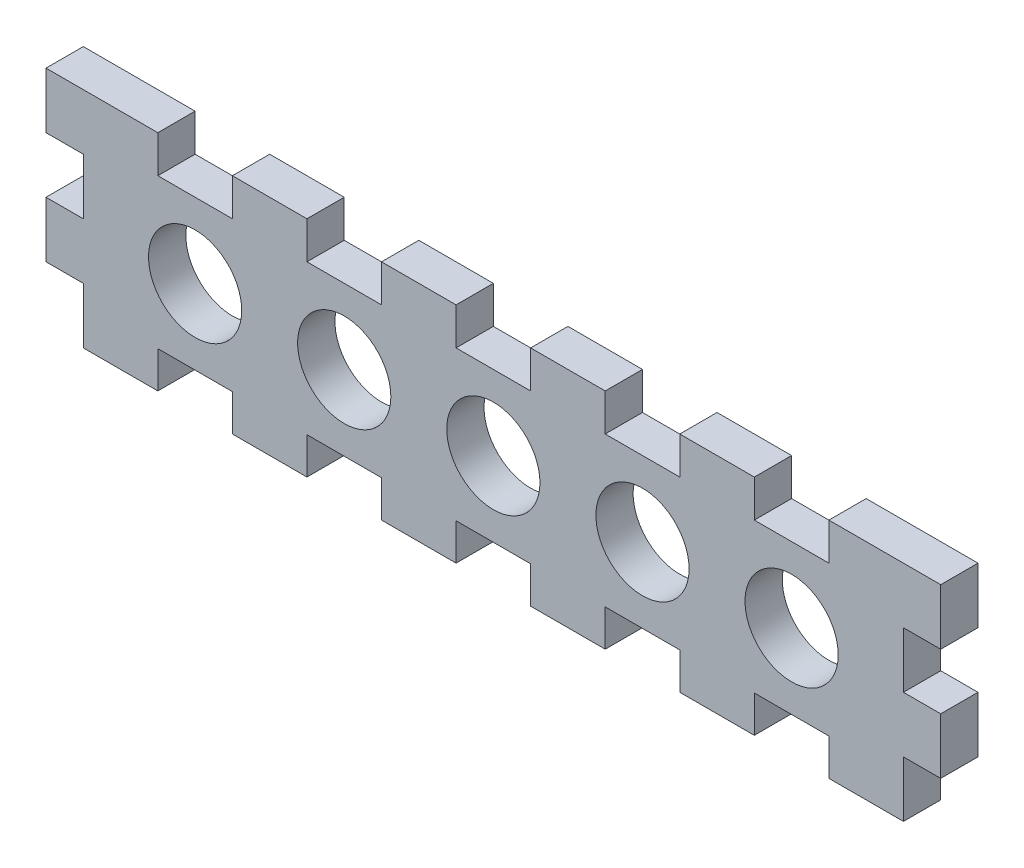
from build123d import *

# Parameters (mm, degrees)
SKETCH1_W             = 152.4
SKETCH1_H             = 38.1
BOSS_EXTRUDE1_DEPTH   = 6.35
CAVITY1_START         = -18.462835622
CAVITY1_OUTLINE_W     = 6.35
CAVITY1_OUTLINE_H     = 6.35
CAVITY1_OUTLINE_W_2   = 6.2484
CAVITY1_DEPTH         = 12.7
CAVITY1_START_2       = 6.937164378
CAVITY1_2_OUTLINE_W   = 6.35
CAVITY1_2_OUTLINE_H   = 6.35
CAVITY1_2_OUTLINE_W_2 = 6.2484
CAVITY1_2_DEPTH       = 12.7
CAVITY1_START_3       = 32.337164378
CAVITY1_3_OUTLINE_W   = 6.35
CAVITY1_3_OUTLINE_H   = 6.35
CAVITY1_3_OUTLINE_W_2 = 6.2484
CAVITY1_3_DEPTH       = 12.7
CAVITY1_START_4       = 57.737164378
CAVITY1_4_OUTLINE_W   = 6.35
CAVITY1_4_OUTLINE_H   = 6.35
CAVITY1_4_OUTLINE_W_2 = 6.2484
CAVITY1_4_DEPTH       = 12.7
CAVITY1_START_5       = 83.137164378
CAVITY1_5_OUTLINE_W   = 6.35
CAVITY1_5_OUTLINE_H   = 6.35
CAVITY1_5_OUTLINE_W_2 = 6.2484
CAVITY1_5_DEPTH       = 12.7
CAVITY1_START_6       = -37.512835622
CAVITY1_6_OUTLINE_W   = 9.525
CAVITY1_6_OUTLINE_H   = 6.35
CAVITY1_6_DEPTH       = 6.35
CAVITY1_START_7       = 108.537164378
CAVITY1_7_OUTLINE_W   = 9.525
CAVITY1_7_OUTLINE_H   = 6.35
CAVITY1_7_DEPTH       = 6.35
SKETCH2_R             = 7.9375
CUT_EXTRUDE1_DEPTH    = 166.74710148
LPATTERN1_COUNT       = 5
LPATTERN1_PITCH       = 25.4


# Read off the part's stored shape, not the designer's step: Cavity1
with BuildPart() as part:
    # Sketch1 → Boss-Extrude1 (new body)
    with BuildSketch(Plane.XY):
        with Locations((38.687164378, -100.250958128)):
            Rectangle(SKETCH1_W, SKETCH1_H)
    extrude(amount=BOSS_EXTRUDE1_DEPTH)

    # Cavity1 outline → Cavity1 (cut)
    with BuildSketch(Plane.YZ.offset(CAVITY1_START)):
        with Locations((-84.375958128, 3.175)):
            Rectangle(CAVITY1_OUTLINE_W, CAVITY1_OUTLINE_H)
        with Locations((-116.176758128, 3.175)):
            Rectangle(CAVITY1_OUTLINE_W_2, CAVITY1_OUTLINE_H)
    extrude(amount=CAVITY1_DEPTH, mode=Mode.SUBTRACT)

    # Cavity1 2 outline → Cavity1 2 (cut)
    with BuildSketch(Plane.YZ.offset(CAVITY1_START_2)):
        with Locations((-84.375958128, 3.175)):
            Rectangle(CAVITY1_2_OUTLINE_W, CAVITY1_2_OUTLINE_H)
        with Locations((-116.176758128, 3.175)):
            Rectangle(CAVITY1_2_OUTLINE_W_2, CAVITY1_2_OUTLINE_H)
    extrude(amount=CAVITY1_2_DEPTH, mode=Mode.SUBTRACT)

    # Cavity1 3 outline → Cavity1 3 (cut)
    with BuildSketch(Plane.YZ.offset(CAVITY1_START_3)):
        with Locations((-84.375958128, 3.175)):
            Rectangle(CAVITY1_3_OUTLINE_W, CAVITY1_3_OUTLINE_H)
        with Locations((-116.176758128, 3.175)):
            Rectangle(CAVITY1_3_OUTLINE_W_2, CAVITY1_3_OUTLINE_H)
    extrude(amount=CAVITY1_3_DEPTH, mode=Mode.SUBTRACT)

    # Cavity1 4 outline → Cavity1 4 (cut)
    with BuildSketch(Plane.YZ.offset(CAVITY1_START_4)):
        with Locations((-84.375958128, 3.175)):
            Rectangle(CAVITY1_4_OUTLINE_W, CAVITY1_4_OUTLINE_H)
        with Locations((-116.176758128, 3.175)):
            Rectangle(CAVITY1_4_OUTLINE_W_2, CAVITY1_4_OUTLINE_H)
    extrude(amount=CAVITY1_4_DEPTH, mode=Mode.SUBTRACT)

    # Cavity1 5 outline → Cavity1 5 (cut)
    with BuildSketch(Plane.YZ.offset(CAVITY1_START_5)):
        with Locations((-84.375958128, 3.175)):
            Rectangle(CAVITY1_5_OUTLINE_W, CAVITY1_5_OUTLINE_H)
        with Locations((-116.176758128, 3.175)):
            Rectangle(CAVITY1_5_OUTLINE_W_2, CAVITY1_5_OUTLINE_H)
    extrude(amount=CAVITY1_5_DEPTH, mode=Mode.SUBTRACT)

    # Cavity1 6 outline → Cavity1 6 (cut)
    with BuildSketch(Plane.YZ.offset(CAVITY1_START_6)):
        with Locations((-95.488458128, 3.175)):
            Rectangle(CAVITY1_6_OUTLINE_W, CAVITY1_6_OUTLINE_H)
        with Locations((-114.538458128, 3.175)):
            Rectangle(CAVITY1_6_OUTLINE_W, CAVITY1_6_OUTLINE_H)
    extrude(amount=CAVITY1_6_DEPTH, mode=Mode.SUBTRACT)

    # Cavity1 7 outline → Cavity1 7 (cut)
    with BuildSketch(Plane.YZ.offset(CAVITY1_START_7)):
        with Locations((-95.488458128, 3.175)):
            Rectangle(CAVITY1_7_OUTLINE_W, CAVITY1_7_OUTLINE_H)
        with Locations((-114.538458128, 3.175)):
            Rectangle(CAVITY1_7_OUTLINE_W, CAVITY1_7_OUTLINE_H)
    extrude(amount=CAVITY1_7_DEPTH, mode=Mode.SUBTRACT)

    # Sketch2 → Cut-Extrude1 (cut, through all)
    with BuildSketch(Plane.XY.offset(6.35)):
        with Locations((-12.112835622, -100.301758128)):
            Circle(SKETCH2_R)
    cut_extrude1 = extrude(amount=-CUT_EXTRUDE1_DEPTH, mode=Mode.SUBTRACT)

    # LPattern1: Cut-Extrude1 ×5
    with Locations(*[(i * LPATTERN1_PITCH, 0, 0) for i in range(1, LPATTERN1_COUNT)]):
        add(cut_extrude1, mode=Mode.SUBTRACT)


solid = part.part
